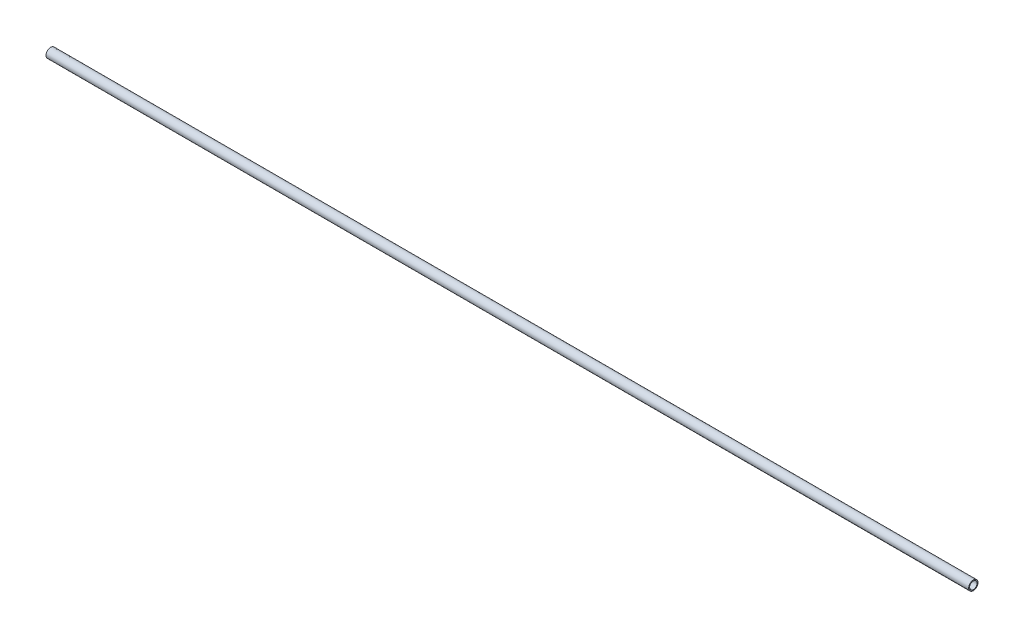
from build123d import *

# Parameters (mm, degrees)
SKETCH1_R           = 0.254
SKETCH1_R_2         = 0.2032
BOSS_EXTRUDE1_DEPTH = 50


with BuildPart() as part:
    # Sketch1 → Boss-Extrude1 (new body)
    with BuildSketch(Plane(origin=(0, 0, 0), x_dir=(0, 0, -1), z_dir=(1, 0, 0))):
        Circle(SKETCH1_R)
        Circle(SKETCH1_R_2, mode=Mode.SUBTRACT)
    extrude(amount=BOSS_EXTRUDE1_DEPTH)


solid = part.part
